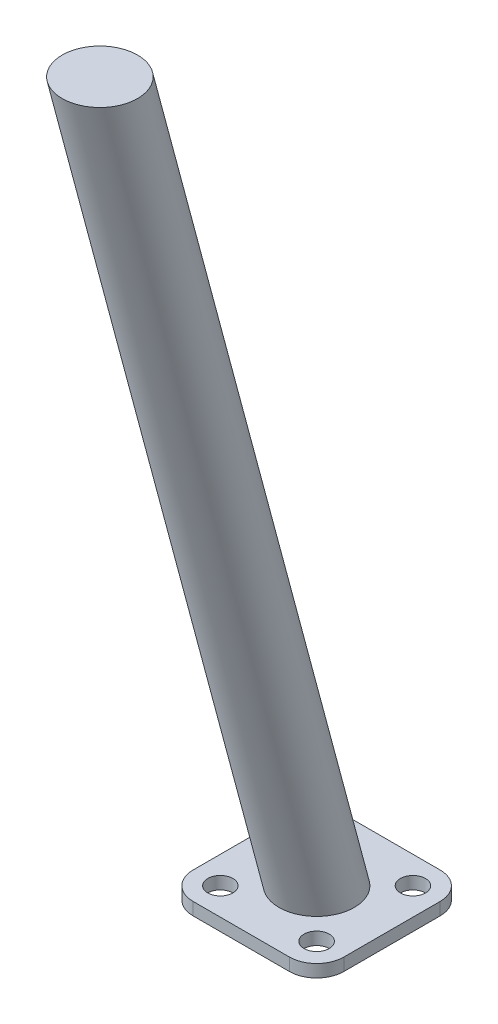
from build123d import *

# Parameters (mm, degrees)
SKETCH1_R           = 1.5
BOSS_EXTRUDE1_DEPTH = 1.5
SKETCH2_R           = 4.5
BOSS_EXTRUDE2_DEPTH = 100


with BuildPart() as part:
    # Sketch1 → Boss-Extrude1 (new body)
    with BuildSketch(Plane(origin=(0, 0, 0), x_dir=(1, 0, 0), z_dir=(0, 1, 0))):
        with BuildLine():
            Line((5.75, 9), (-5.75, 9))
            ThreePointArc((-5.75, 9), (-8.048097039, 8.048097039), (-9, 5.75))
            Line((-9, 5.75), (-9, -5.75))
            ThreePointArc((-9, -5.75), (-8.048097039, -8.048097039), (-5.75, -9))
            Line((-5.75, -9), (5.75, -9))
            ThreePointArc((5.75, -9), (8.048097039, -8.048097039), (9, -5.75))
            Line((9, -5.75), (9, 5.75))
            ThreePointArc((9, 5.75), (8.048097039, 8.048097039), (5.75, 9))
        make_face()
        with Locations((5.75, 5.75)):
            Circle(SKETCH1_R, mode=Mode.SUBTRACT)
        with Locations((5.75, -5.75)):
            Circle(SKETCH1_R, mode=Mode.SUBTRACT)
        with Locations((-5.75, -5.75)):
            Circle(SKETCH1_R, mode=Mode.SUBTRACT)
        with Locations((-5.75, 5.75)):
            Circle(SKETCH1_R, mode=Mode.SUBTRACT)
    extrude(amount=BOSS_EXTRUDE1_DEPTH)

    # Sketch2 → Boss-Extrude2 (add, along a direction that is not the sketch's normal)
    with BuildSketch(Plane(origin=(0, 1.5, 0), x_dir=(1, 0, 0), z_dir=(0, 1, 0))):
        Circle(SKETCH2_R)
    extrude(amount=BOSS_EXTRUDE2_DEPTH, dir=(0, 0.9659258262890691, 0.25881904510251774))


solid = part.part
